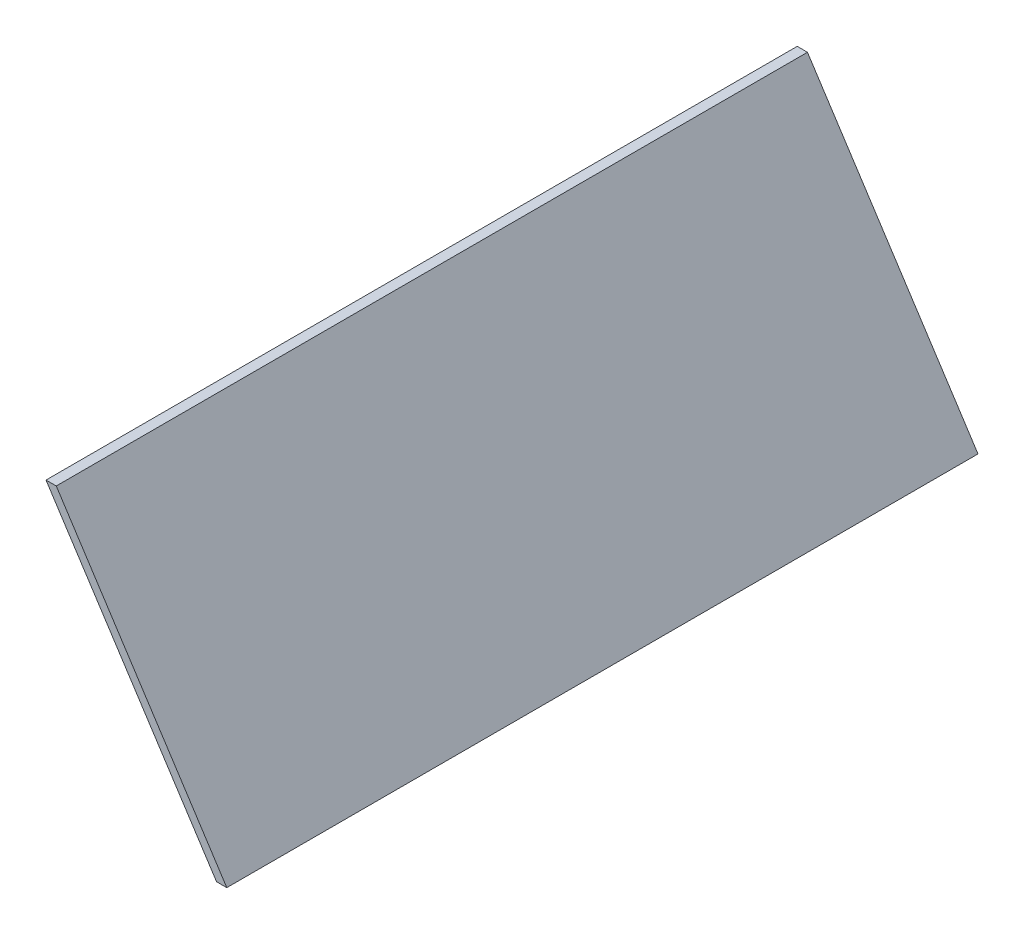
from build123d import *

# Parameters (mm, degrees)
BOSS_EXTRUDE1_DEPTH = 277.48


with BuildPart() as part:
    # Sketch1 → Boss-Extrude1 (new body)
    with BuildSketch(Plane.XY):
        Polygon((-148.626421236, -87.492627434), (-144.840667782, -87.492627434), (-207.833204322, 9.507372566), (-211.618957777, 9.507372566), align=None)
    extrude(amount=BOSS_EXTRUDE1_DEPTH)


solid = part.part
